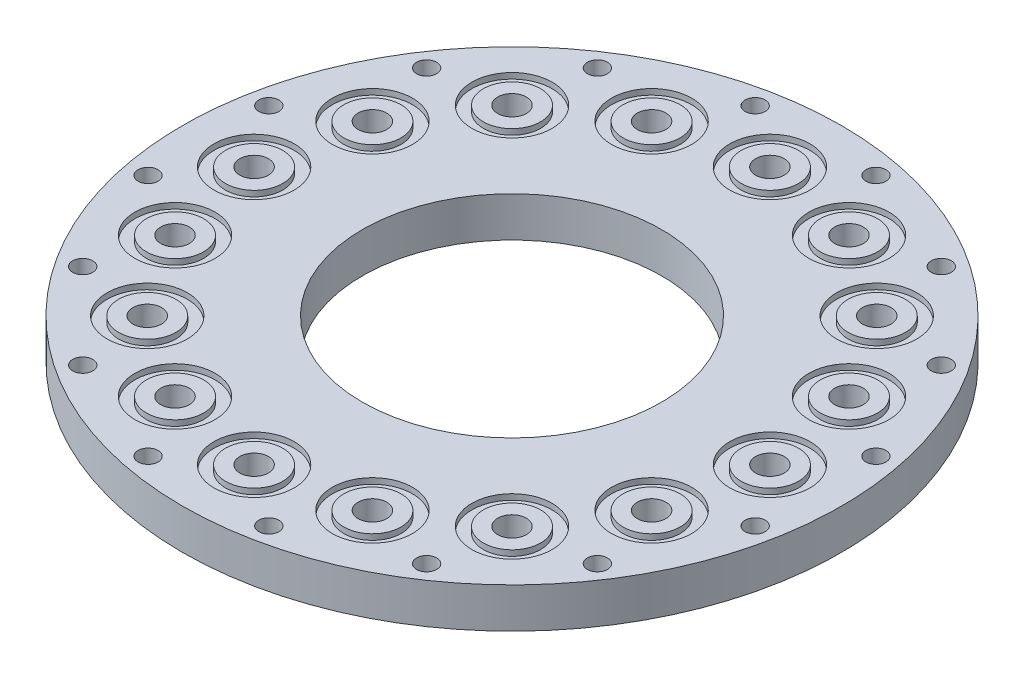
from build123d import *

# Parameters (mm, degrees)
SKETCH1_R           = 57.5
SKETCH1_R_2         = 1.75
SKETCH1_R_3         = 26.1
SKETCH1_R_4         = 2.5
BOSS_EXTRUDE1_DEPTH = 7
SKETCH2_R           = 7
SKETCH2_R_2         = 5
CUT_EXTRUDE1_DEPTH  = 1


with BuildPart() as part:
    # Sketch1 → Boss-Extrude1 (new body)
    with BuildSketch(Plane(origin=(0, 0, 0), x_dir=(1, 0, 0), z_dir=(0, 1, 0))):
        Circle(SKETCH1_R)
        with Locations((-10.534877389, 52.962405142)):
            Circle(SKETCH1_R_2, mode=Mode.SUBTRACT)
        with Locations((10.534877389, 52.962405142)):
            Circle(SKETCH1_R_2, mode=Mode.SUBTRACT)
        with Locations((30.000792583, 44.899359064)):
            Circle(SKETCH1_R_2, mode=Mode.SUBTRACT)
        with Locations((44.899359064, 30.000792583)):
            Circle(SKETCH1_R_2, mode=Mode.SUBTRACT)
        with Locations((52.962405142, 10.534877389)):
            Circle(SKETCH1_R_2, mode=Mode.SUBTRACT)
        with Locations((52.962405142, -10.534877389)):
            Circle(SKETCH1_R_2, mode=Mode.SUBTRACT)
        with Locations((44.899359064, -30.000792583)):
            Circle(SKETCH1_R_2, mode=Mode.SUBTRACT)
        with Locations((30.000792583, -44.899359064)):
            Circle(SKETCH1_R_2, mode=Mode.SUBTRACT)
        with Locations((10.534877389, -52.962405142)):
            Circle(SKETCH1_R_2, mode=Mode.SUBTRACT)
        with Locations((-10.534877389, -52.962405142)):
            Circle(SKETCH1_R_2, mode=Mode.SUBTRACT)
        with Locations((-30.000792583, -44.899359064)):
            Circle(SKETCH1_R_2, mode=Mode.SUBTRACT)
        with Locations((-44.899359064, -30.000792583)):
            Circle(SKETCH1_R_2, mode=Mode.SUBTRACT)
        Circle(SKETCH1_R_3, mode=Mode.SUBTRACT)
        with Locations((0, 45)):
            Circle(SKETCH1_R_4, mode=Mode.SUBTRACT)
        with Locations((17.220754456, 41.574578963)):
            Circle(SKETCH1_R_4, mode=Mode.SUBTRACT)
        with Locations((31.819805153, 31.819805153)):
            Circle(SKETCH1_R_4, mode=Mode.SUBTRACT)
        with Locations((41.574578963, 17.220754456)):
            Circle(SKETCH1_R_4, mode=Mode.SUBTRACT)
        with Locations((45, 0)):
            Circle(SKETCH1_R_4, mode=Mode.SUBTRACT)
        with Locations((41.574578963, -17.220754456)):
            Circle(SKETCH1_R_4, mode=Mode.SUBTRACT)
        with Locations((31.819805153, -31.819805153)):
            Circle(SKETCH1_R_4, mode=Mode.SUBTRACT)
        with Locations((17.220754456, -41.574578963)):
            Circle(SKETCH1_R_4, mode=Mode.SUBTRACT)
        with Locations((0, -45)):
            Circle(SKETCH1_R_4, mode=Mode.SUBTRACT)
        with Locations((-17.220754456, -41.574578963)):
            Circle(SKETCH1_R_4, mode=Mode.SUBTRACT)
        with Locations((-31.819805153, -31.819805153)):
            Circle(SKETCH1_R_4, mode=Mode.SUBTRACT)
        with Locations((-41.574578963, -17.220754456)):
            Circle(SKETCH1_R_4, mode=Mode.SUBTRACT)
        with Locations((-45, 0)):
            Circle(SKETCH1_R_4, mode=Mode.SUBTRACT)
        with Locations((-41.574578963, 17.220754456)):
            Circle(SKETCH1_R_4, mode=Mode.SUBTRACT)
        with Locations((-31.819805153, 31.819805153)):
            Circle(SKETCH1_R_4, mode=Mode.SUBTRACT)
        with Locations((-17.220754456, 41.574578963)):
            Circle(SKETCH1_R_4, mode=Mode.SUBTRACT)
        with Locations((-52.962405142, -10.534877389)):
            Circle(SKETCH1_R_2, mode=Mode.SUBTRACT)
        with Locations((-52.962405142, 10.534877389)):
            Circle(SKETCH1_R_2, mode=Mode.SUBTRACT)
        with Locations((-44.899359064, 30.000792583)):
            Circle(SKETCH1_R_2, mode=Mode.SUBTRACT)
        with Locations((-30.000792583, 44.899359064)):
            Circle(SKETCH1_R_2, mode=Mode.SUBTRACT)
    extrude(amount=BOSS_EXTRUDE1_DEPTH)

    # Sketch2 → Cut-Extrude1 (cut)
    # profile 1 of 16: a face of its own
    with BuildSketch(Plane(origin=(0, 7, 0), x_dir=(1, 0, 0), z_dir=(0, 1, 0))):
        with Locations((0, 45)):
            Circle(SKETCH2_R)
        with Locations((0, 45)):
            Circle(SKETCH2_R_2, mode=Mode.SUBTRACT)
    # profile 2 of 16: a face of its own
    with BuildSketch(Plane(origin=(0, 7, 0), x_dir=(1, 0, 0), z_dir=(0, 1, 0))):
        with Locations((17.220754456, 41.574578963)):
            Circle(SKETCH2_R)
        with Locations((17.220754456, 41.574578963)):
            Circle(SKETCH2_R_2, mode=Mode.SUBTRACT)
    # profile 3 of 16: a face of its own
    with BuildSketch(Plane(origin=(0, 7, 0), x_dir=(1, 0, 0), z_dir=(0, 1, 0))):
        with Locations((31.819805153, 31.819805153)):
            Circle(SKETCH2_R)
        with Locations((31.819805153, 31.819805153)):
            Circle(SKETCH2_R_2, mode=Mode.SUBTRACT)
    # profile 4 of 16: a face of its own
    with BuildSketch(Plane(origin=(0, 7, 0), x_dir=(1, 0, 0), z_dir=(0, 1, 0))):
        with Locations((41.574578963, 17.220754456)):
            Circle(SKETCH2_R)
        with Locations((41.574578963, 17.220754456)):
            Circle(SKETCH2_R_2, mode=Mode.SUBTRACT)
    # profile 5 of 16: a face of its own
    with BuildSketch(Plane(origin=(0, 7, 0), x_dir=(1, 0, 0), z_dir=(0, 1, 0))):
        with Locations((45, 0)):
            Circle(SKETCH2_R)
        with Locations((45, 0)):
            Circle(SKETCH2_R_2, mode=Mode.SUBTRACT)
    # profile 6 of 16: a face of its own
    with BuildSketch(Plane(origin=(0, 7, 0), x_dir=(1, 0, 0), z_dir=(0, 1, 0))):
        with Locations((41.574578963, -17.220754456)):
            Circle(SKETCH2_R)
        with Locations((41.574578963, -17.220754456)):
            Circle(SKETCH2_R_2, mode=Mode.SUBTRACT)
    # profile 7 of 16: a face of its own
    with BuildSketch(Plane(origin=(0, 7, 0), x_dir=(1, 0, 0), z_dir=(0, 1, 0))):
        with Locations((31.819805153, -31.819805153)):
            Circle(SKETCH2_R)
        with Locations((31.819805153, -31.819805153)):
            Circle(SKETCH2_R_2, mode=Mode.SUBTRACT)
    # profile 8 of 16: a face of its own
    with BuildSketch(Plane(origin=(0, 7, 0), x_dir=(1, 0, 0), z_dir=(0, 1, 0))):
        with Locations((17.220754456, -41.574578963)):
            Circle(SKETCH2_R)
        with Locations((17.220754456, -41.574578963)):
            Circle(SKETCH2_R_2, mode=Mode.SUBTRACT)
    # profile 9 of 16: a face of its own
    with BuildSketch(Plane(origin=(0, 7, 0), x_dir=(1, 0, 0), z_dir=(0, 1, 0))):
        with Locations((0, -45)):
            Circle(SKETCH2_R)
        with Locations((0, -45)):
            Circle(SKETCH2_R_2, mode=Mode.SUBTRACT)
    # profile 10 of 16: a face of its own
    with BuildSketch(Plane(origin=(0, 7, 0), x_dir=(1, 0, 0), z_dir=(0, 1, 0))):
        with Locations((-17.220754456, -41.574578963)):
            Circle(SKETCH2_R)
        with Locations((-17.220754456, -41.574578963)):
            Circle(SKETCH2_R_2, mode=Mode.SUBTRACT)
    # profile 11 of 16: a face of its own
    with BuildSketch(Plane(origin=(0, 7, 0), x_dir=(1, 0, 0), z_dir=(0, 1, 0))):
        with Locations((-31.819805153, -31.819805153)):
            Circle(SKETCH2_R)
        with Locations((-31.819805153, -31.819805153)):
            Circle(SKETCH2_R_2, mode=Mode.SUBTRACT)
    # profile 12 of 16: a face of its own
    with BuildSketch(Plane(origin=(0, 7, 0), x_dir=(1, 0, 0), z_dir=(0, 1, 0))):
        with Locations((-41.574578963, -17.220754456)):
            Circle(SKETCH2_R)
        with Locations((-41.574578963, -17.220754456)):
            Circle(SKETCH2_R_2, mode=Mode.SUBTRACT)
    # profile 13 of 16: a face of its own
    with BuildSketch(Plane(origin=(0, 7, 0), x_dir=(1, 0, 0), z_dir=(0, 1, 0))):
        with Locations((-45, 0)):
            Circle(SKETCH2_R)
        with Locations((-45, 0)):
            Circle(SKETCH2_R_2, mode=Mode.SUBTRACT)
    # profile 14 of 16: a face of its own
    with BuildSketch(Plane(origin=(0, 7, 0), x_dir=(1, 0, 0), z_dir=(0, 1, 0))):
        with Locations((-41.574578963, 17.220754456)):
            Circle(SKETCH2_R)
        with Locations((-41.574578963, 17.220754456)):
            Circle(SKETCH2_R_2, mode=Mode.SUBTRACT)
    # profile 15 of 16: a face of its own
    with BuildSketch(Plane(origin=(0, 7, 0), x_dir=(1, 0, 0), z_dir=(0, 1, 0))):
        with Locations((-31.819805153, 31.819805153)):
            Circle(SKETCH2_R)
        with Locations((-31.819805153, 31.819805153)):
            Circle(SKETCH2_R_2, mode=Mode.SUBTRACT)
    # profile 16 of 16: a face of its own
    with BuildSketch(Plane(origin=(0, 7, 0), x_dir=(1, 0, 0), z_dir=(0, 1, 0))):
        with Locations((-17.220754456, 41.574578963)):
            Circle(SKETCH2_R)
        with Locations((-17.220754456, 41.574578963)):
            Circle(SKETCH2_R_2, mode=Mode.SUBTRACT)
    extrude(amount=-CUT_EXTRUDE1_DEPTH, mode=Mode.SUBTRACT)


solid = part.part
